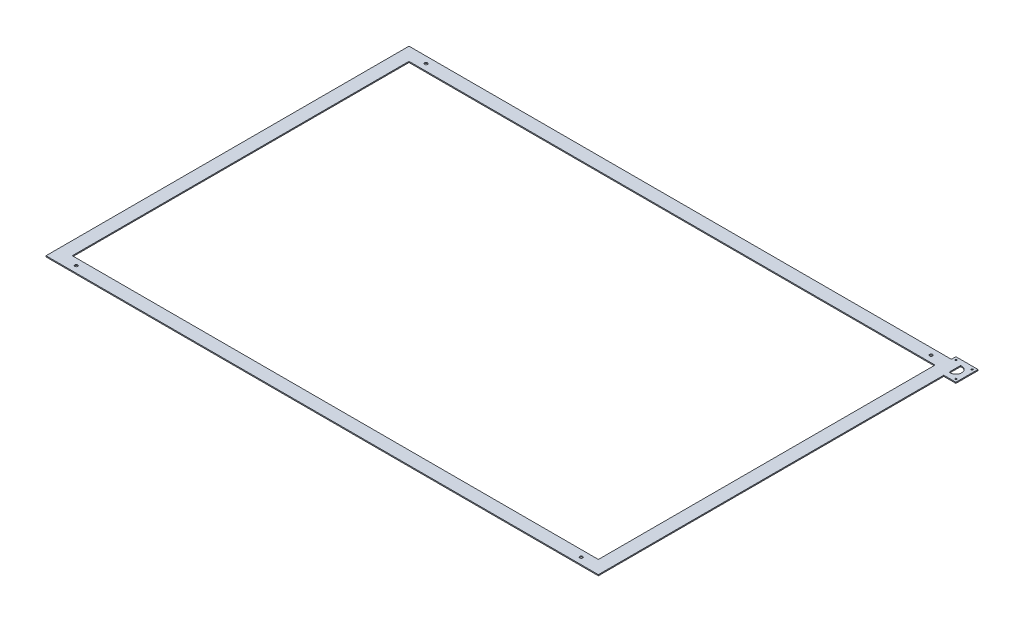
from build123d import *

# Parameters (mm, degrees)
ESQUISSE1_W             = 1050
ESQUISSE1_H             = 690
ESQUISSE1_W_2           = 1000
ESQUISSE1_H_2           = 640
BOSS_EXTRU_1_DEPTH      = 2
ESQUISSE2_R             = 2.75
ENL_V_MAT_EXTRU_1_DEPTH = 2
ESQUISSE3_R             = 1.5
BOSS_EXTRU_2_DEPTH      = 2


with BuildPart() as part:
    # Esquisse1 → Boss.-Extru.1 (new body)
    with BuildSketch(Plane(origin=(0, 0, 0), x_dir=(1, 0, 0), z_dir=(0, 1, 0))):
        with Locations((295.960935162, 191.301214666)):
            Rectangle(ESQUISSE1_W, ESQUISSE1_H)
        with Locations((295.960935162, 191.301214666)):
            Rectangle(ESQUISSE1_W_2, ESQUISSE1_H_2, mode=Mode.SUBTRACT)
    extrude(amount=BOSS_EXTRU_1_DEPTH)

    # Esquisse2 → Enlèv. mat.-Extru.1 (cut)
    with BuildSketch(Plane(origin=(0, 2, 0), x_dir=(1, 0, 0), z_dir=(0, 1, 0))):
        with Locations((-184.039064838, -141.198785334)):
            Circle(ESQUISSE2_R)
        with Locations((775.960935162, -141.198785334)):
            Circle(ESQUISSE2_R)
        with Locations((775.960935162, 523.801214666)):
            Circle(ESQUISSE2_R)
        with Locations((-184.039064838, 523.801214666)):
            Circle(ESQUISSE2_R)
    extrude(amount=-ENL_V_MAT_EXTRU_1_DEPTH, mode=Mode.SUBTRACT)

    # Esquisse3 → Boss.-Extru.2 (add)
    with BuildSketch(Plane(origin=(0, 2, 0), x_dir=(1, 0, 0), z_dir=(0, 1, 0))):
        with BuildLine():
            Line((844.002764628, 544.889992422), (802.002764628, 544.889992422))
            Line((802.002764628, 544.889992422), (802.002764628, 536.301214666))
            Line((802.002764628, 536.301214666), (820.960935162, 536.301214666))
            Line((820.960935162, 536.301214666), (820.960935162, 534.698828272))
            ThreePointArc((820.960935162, 534.698828272), (834.002764628, 523.889992422), (820.960935162, 513.081156572))
            Line((820.960935162, 513.081156572), (820.960935162, 502.889992422))
            Line((820.960935162, 502.889992422), (844.002764628, 502.889992422))
            Line((844.002764628, 502.889992422), (844.002764628, 544.889992422))
        make_face()
        with Locations((838.502764628, 508.389992422)):
            Circle(ESQUISSE3_R, mode=Mode.SUBTRACT)
        with Locations((838.502764628, 539.389992422)):
            Circle(ESQUISSE3_R, mode=Mode.SUBTRACT)
        with Locations((807.502764628, 539.389992422)):
            Circle(ESQUISSE3_R, mode=Mode.SUBTRACT)
    extrude(amount=-BOSS_EXTRU_2_DEPTH)


solid = part.part
